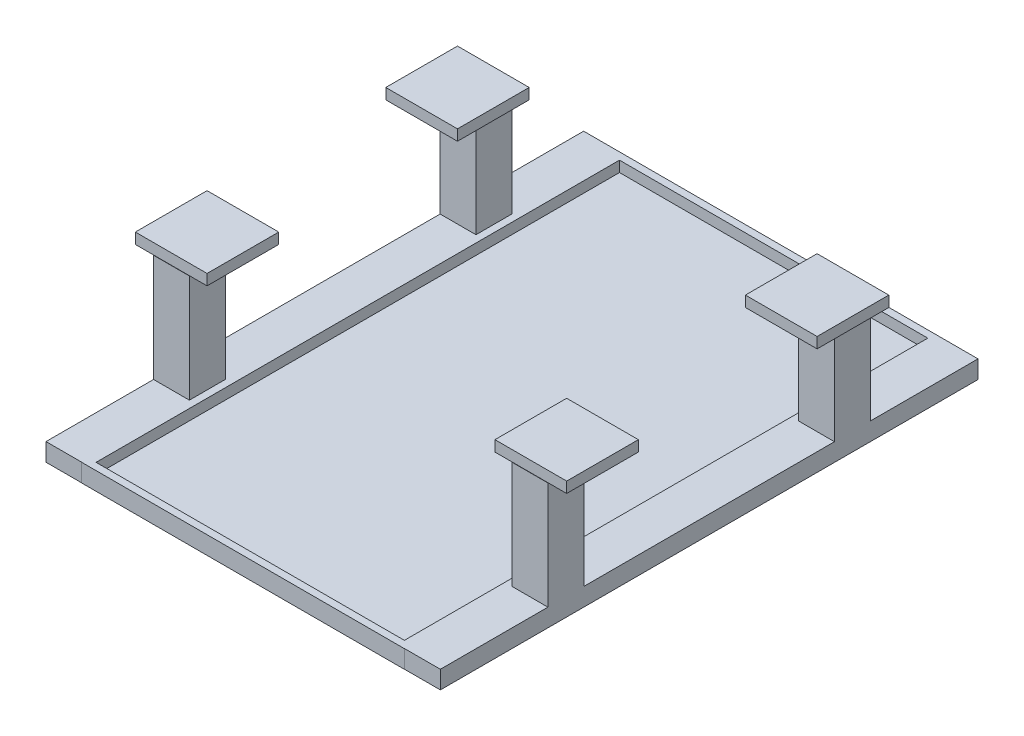
from build123d import *

# Parameters (mm, degrees)
SKETCH1_W           = 90
SKETCH1_H           = 150
BOSS_EXTRUDE1_DEPTH = 5
SHELL1_T            = -2
SKETCH2_W           = 10
SKETCH2_H           = 10
BOSS_EXTRUDE2_DEPTH = 35
SKETCH4_W           = 20
SKETCH4_H           = 20
SKETCH4_W_2         = 20.000138365
BOSS_EXTRUDE7_DEPTH = 3
SKETCH5_W           = 10
SKETCH5_H           = 5
BOSS_EXTRUDE4_DEPTH = 30
SKETCH6_W           = 69.9306589
SKETCH6_H           = 5
SKETCH6_W_2         = 30.03467055
BOSS_EXTRUDE5_DEPTH = 10
SKETCH8_W           = 69.9306589
SKETCH8_H           = 5
SKETCH8_W_2         = 30.03467055
BOSS_EXTRUDE6_DEPTH = 10


with BuildPart() as part:
    # Sketch1 → Boss-Extrude1 (new body)
    with BuildSketch(Plane(origin=(0, 0, 0), x_dir=(1, 0, 0), z_dir=(0, 1, 0))):
        Rectangle(SKETCH1_W, SKETCH1_H)
    extrude(amount=BOSS_EXTRUDE1_DEPTH)

    # Shell1
    shell1_openings = [part.faces().sort_by_distance(p)[0] for p in [
        (0, 5, 0),
    ]]
    offset(amount=SHELL1_T, openings=shell1_openings, kind=Kind.INTERSECTION)

    # Sketch2 → Boss-Extrude2 (add)
    with BuildSketch(Plane(origin=(0, 0, 0), x_dir=(1, 0, 0), z_dir=(0, 1, 0))):
        with Locations((50, 39.96532945)):
            Rectangle(SKETCH2_W, SKETCH2_H)
        with Locations((-50, 39.96532945)):
            Rectangle(SKETCH2_W, SKETCH2_H)
        with Locations((50, -39.96532945)):
            Rectangle(SKETCH2_W, SKETCH2_H)
        with Locations((-50, -39.96532945)):
            Rectangle(SKETCH2_W, SKETCH2_H)
    extrude(amount=BOSS_EXTRUDE2_DEPTH)

    # Sketch4 → Boss-Extrude7 (add)
    with BuildSketch(Plane(origin=(0, 35, 0), x_dir=(1, 0, 0), z_dir=(0, 1, 0))):
        with Locations((-50.15396044, 34.96532945)):
            Rectangle(SKETCH4_W, SKETCH4_H)
        with Locations((50.15396044, 34.96532945)):
            Rectangle(SKETCH4_W, SKETCH4_H)
        with Locations((-50.153891258, -34.890934364)):
            Rectangle(SKETCH4_W_2, SKETCH4_H)
        with Locations((50.153891258, -34.890934364)):
            Rectangle(SKETCH4_W_2, SKETCH4_H)
    extrude(amount=BOSS_EXTRUDE7_DEPTH)

    # Sketch5 → Boss-Extrude4 (add)
    with BuildSketch(Plane.XY.offset(44.96532945)):
        with Locations((-50, 2.5)):
            Rectangle(SKETCH5_W, SKETCH5_H)
        with Locations((50, 2.5)):
            Rectangle(SKETCH5_W, SKETCH5_H)
    extrude(amount=BOSS_EXTRUDE4_DEPTH)

    # Sketch6 → Boss-Extrude5 (add)
    with BuildSketch(Plane(origin=(45, 0, 0), x_dir=(0, 0, -1), z_dir=(1, 0, 0))):
        with Locations((0, 2.5)):
            Rectangle(SKETCH6_W, SKETCH6_H)
        with Locations((59.982664725, 2.5)):
            Rectangle(SKETCH6_W_2, SKETCH6_H)
    extrude(amount=BOSS_EXTRUDE5_DEPTH)

    # Sketch8 → Boss-Extrude6 (add)
    with BuildSketch(Plane.ZY.offset(45)):
        with Locations((0, 2.5)):
            Rectangle(SKETCH8_W, SKETCH8_H)
        with Locations((-59.982664725, 2.5)):
            Rectangle(SKETCH8_W_2, SKETCH8_H)
    extrude(amount=BOSS_EXTRUDE6_DEPTH)


solid = part.part
